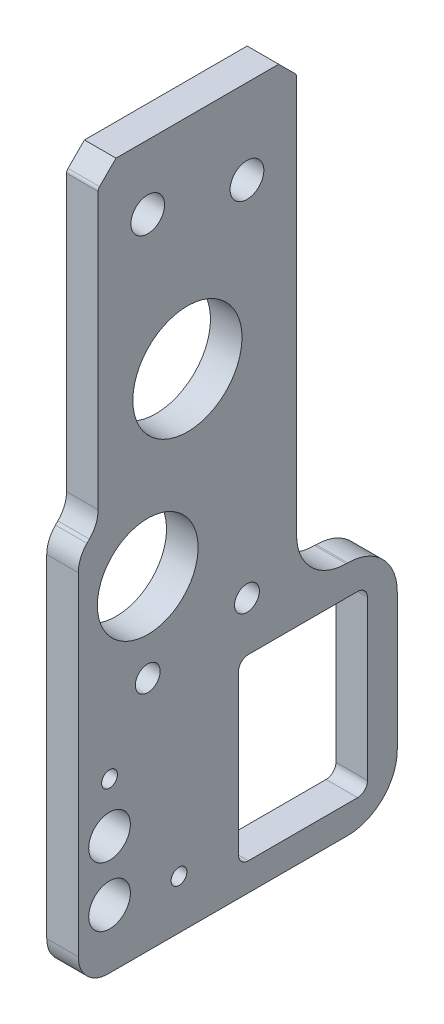
from build123d import *

# Parameters (mm, degrees)
SKETCH1_R             = 5.075
SKETCH1_R_2           = 1.7
SKETCH1_R_3           = 2.1
SKETCH1_R_4           = 0.8
SKETCH1_W             = 13
SKETCH1_H             = 18
BOSS_EXTRUDE1_DEPTH   = 3.18
SKETCH3_R             = 5.5
CUT_EXTRUDE4_DEPTH    = 78.831812262
FILLET2_R             = 3
CHAMFER2_SIZE         = 1.8
FILLET4_R             = 0.5
M2_TAPPED_HOLE1_D     = 1.6
FILLET9_R             = 1
FILLET11_R            = 5
M3X0_5_TAPPED_HOLE1_D = 2.5


with BuildPart() as part:
    # Sketch1 → Boss-Extrude1 (new body)
    with BuildSketch(Plane(origin=(0, 0, 0), x_dir=(0, 0, -1), z_dir=(1, 0, 0))):
        Polygon((0, 0), (0, 37.775), (2, 39.775), (2, 70.81), (22, 70.81), (22, 23.81), (32.15, 23.81), (32.15, 0), align=None)
        with Locations((7, 32.7)):
            Circle(SKETCH1_R, mode=Mode.SUBTRACT)
        with Locations((7, 64.31)):
            Circle(SKETCH1_R_2, mode=Mode.SUBTRACT)
        with Locations((17, 62.31)):
            Circle(SKETCH1_R_2, mode=Mode.SUBTRACT)
        with Locations((3.15, 5.95)):
            Circle(SKETCH1_R_3, mode=Mode.SUBTRACT)
        with Locations((3.15, 11.95)):
            Circle(SKETCH1_R_3, mode=Mode.SUBTRACT)
        with Locations((10.15, 4.95)):
            Circle(SKETCH1_R_4, mode=Mode.SUBTRACT)
        with Locations((3.15, 16.95)):
            Circle(SKETCH1_R_4, mode=Mode.SUBTRACT)
        with Locations((22.65, 11.81)):
            Rectangle(SKETCH1_W, SKETCH1_H, mode=Mode.SUBTRACT)
    extrude(amount=BOSS_EXTRUDE1_DEPTH)

    # Sketch3 → Cut-Extrude4 (cut, through all)
    with BuildSketch(Plane.ZY):
        with Locations((-11, 48.810865899)):
            Circle(SKETCH3_R)
    extrude(amount=-CUT_EXTRUDE4_DEPTH, mode=Mode.SUBTRACT)

    # Fillet2
    fillet2_edges = [part.edges().sort_by_distance(p)[0] for p in [
        (1.59, 37.775, 0),
        (1.59, 39.775, -2),
        (1.59, 0, 0),
    ]]
    fillet(fillet2_edges, radius=FILLET2_R)

    # Chamfer2
    chamfer2_edges = [part.edges().sort_by_distance(p)[0] for p in [
        (1.59, 70.81, -22),
        (1.59, 70.81, -2),
    ]]
    chamfer(chamfer2_edges, length=CHAMFER2_SIZE)

    # Fillet4
    fillet4_edges = [part.edges().sort_by_distance(p)[0] for p in [
        (1.59, 69.01, -2),
        (1.59, 69.01, -22),
    ]]
    fillet(fillet4_edges, radius=FILLET4_R)

    # M2 Tapped Hole1 (through all)
    with Locations(Plane(origin=(0, 16.95, -3.15), x_dir=(0, 0, -1), z_dir=(-1, 0, 0))):
        with Locations((0, 0), (7, 12)):
            Hole(M2_TAPPED_HOLE1_D / 2)

    # Fillet9
    fillet9_edges = [part.edges().sort_by_distance(p)[0] for p in [
        (1.59, 2.81, -29.15),
        (1.59, 2.81, -16.15),
        (1.59, 20.81, -29.15),
        (1.59, 20.81, -16.15),
    ]]
    fillet(fillet9_edges, radius=FILLET9_R)

    # Fillet11
    fillet11_edges = [part.edges().sort_by_distance(p)[0] for p in [
        (1.59, 0, -32.15),
        (1.59, 23.81, -22),
        (1.59, 23.81, -32.15),
    ]]
    fillet(fillet11_edges, radius=FILLET11_R)

    # M3x0.5 Tapped Hole1 (through all)
    with Locations(Plane(origin=(3.18, 0, 0), x_dir=(0, 0, -1), z_dir=(1, 0, 0))):
        with Locations((7, 23.81), (17, 25.81)):
            Hole(M3X0_5_TAPPED_HOLE1_D / 2)


solid = part.part
